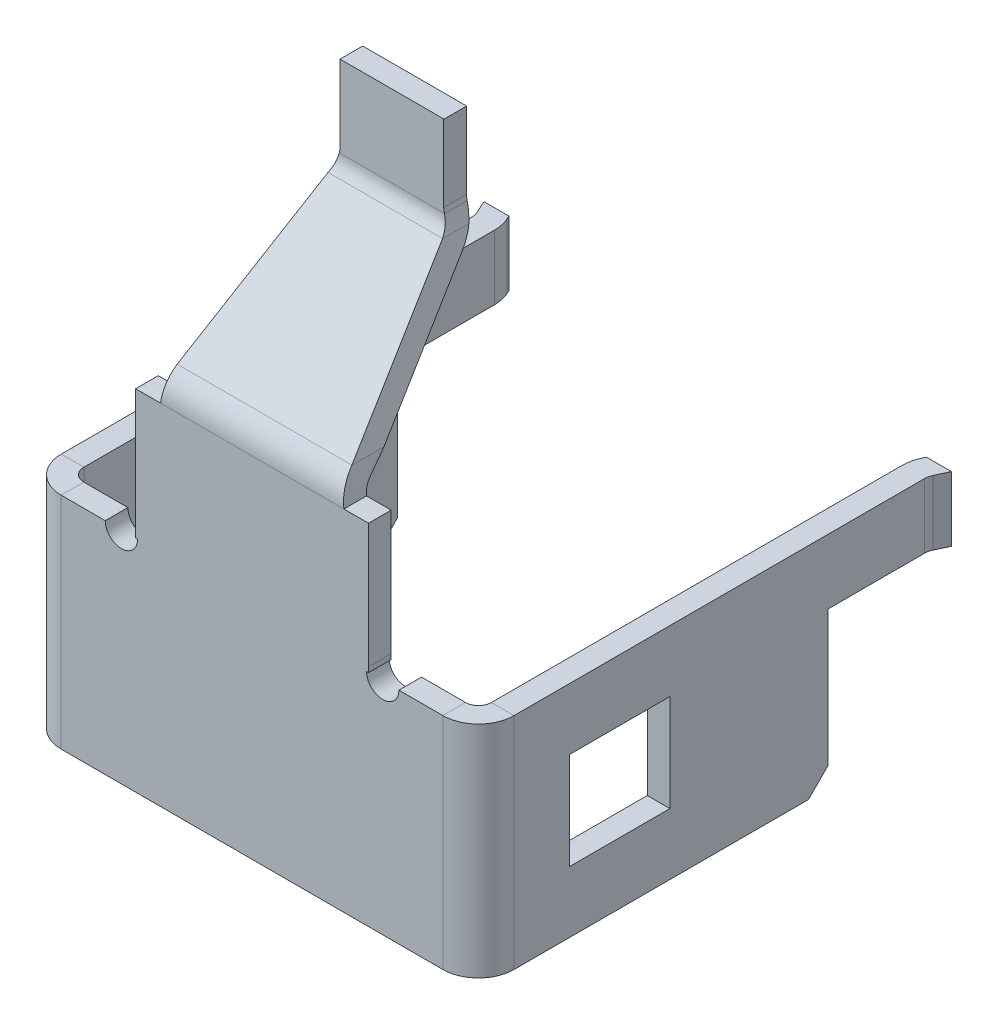
from build123d import *

# Parameters (mm, degrees)
DODANIE_WYCI_GNI_CIE1_DEPTH     = 0.35
DODANIE_WYCI_GNI_CIE2_DEPTH     = 3.4
WYTNIJ_WYCI_GNI_CIE1_DEPTH      = 12.253852902
WYTNIJ_WYCI_GNI_CIE1_DEPTH_BACK = 12.253852902
SZKIC3_W                        = 1.55
SZKIC3_H                        = 1.5
KONWERTUJ_BRY_1_DEPTH           = 3.4
KONWERTUJ_BRY_1_2_DEPTH         = 3.4
DODANIE_WYCI_GNI_CIE3_DEPTH     = 1
DODANIE_WYCI_GNI_CIE4_START     = -1.7
DODANIE_WYCI_GNI_CIE4_DEPTH     = 3.6
WYTNIJ_WYCI_GNI_CIE2_DEPTH      = 13.252457687


# Read off the part's stored shape, not the designer's step: Konwertuj bryłę1
with BuildPart() as part:
    # Szkic1 → Dodanie-wyciągnięcie1 (new body)
    with BuildSketch(Plane.XY):
        with BuildLine():
            Line((3.5, 0), (3.5, 3.4))
            Line((3.5, 3.4), (3.1, 3.4))
            Line((3.1, 3.4), (2.269798394, 3.4))
            ThreePointArc((2.269798394, 3.4), (2.019798394, 3.15), (1.769798394, 3.4))
            Line((1.769798394, 3.4), (1.417144432, 5.4))
            Line((1.417144432, 5.4), (-1.417144432, 5.4))
            Line((-1.417144432, 5.4), (-1.769798394, 3.4))
            ThreePointArc((-1.769798394, 3.4), (-2.019798394, 3.15), (-2.269798394, 3.4))
            Line((-2.269798394, 3.4), (-3.1, 3.4))
            Line((-3.1, 3.4), (-3.5, 3.4))
            Line((-3.5, 3.4), (-3.5, 0))
            Line((-3.5, 0), (-3.1, 0))
            Line((-3.1, 0), (3.1, 0))
            Line((3.1, 0), (3.5, 0))
        make_face()
    extrude(amount=DODANIE_WYCI_GNI_CIE1_DEPTH)

    # Szkic2 → Dodanie-wyciągnięcie2 (add)
    with BuildSketch(Plane.XZ):
        with BuildLine():
            Line((3.15, -5.046862694), (3.15, -6.546862697))
            ThreePointArc((3.15, -6.546862697), (3.164222396, -6.676726465), (3.206215328, -6.800433654))
            Line((3.206215328, -6.800433654), (3.227865546, -6.846862697))
            Line((3.227865546, -6.846862697), (3.614047818, -6.846862697))
            Line((3.614047818, -6.846862697), (3.523423053, -6.652517262))
            ThreePointArc((3.523423053, -6.652517262), (3.505925998, -6.6009726), (3.5, -6.546862697))
            Line((3.5, -6.546862697), (3.5, -5.046862694))
            Line((3.5, -5.046862694), (3.5, -4.746862694))
            Line((3.5, -4.746862694), (3.5, -0.046862697))
            Line((3.5, -0.046862697), (3.5, 0))
            Line((3.5, 0), (3.15, 0))
            Line((3.15, 0), (3.15, -0.046862697))
            Line((3.15, -0.046862697), (3.15, -4.746862694))
            Line((3.15, -4.746862694), (3.15, -5.046862694))
        make_face()
    dodanie_wyci_gni_cie2 = extrude(amount=-DODANIE_WYCI_GNI_CIE2_DEPTH)

    # Lustro1: Dodanie-wyciągnięcie2 across plane
    add(dodanie_wyci_gni_cie2.mirror(Plane(origin=(0, 0, 0), x_dir=(0, 0, 1), z_dir=(1, 0, 0))))

    # Szkic3 → Wytnij-wyciągnięcie1 (cut, two sides: drawn at the far end of the back side and taken through both)
    with BuildSketch(Plane(origin=(3.5, 0, 0), x_dir=(0, 0, -1), z_dir=(1, 0, 0)).offset(-WYTNIJ_WYCI_GNI_CIE1_DEPTH_BACK)):
        with Locations((1.834568124, 1.7)):
            Rectangle(SZKIC3_W, SZKIC3_H)
        Polygon((6.85, 2.4), (6.655654565, 2.4), (6.55, 2.4), (6.546862697, 2.4), (6.546862697, 0), (4.749999997, 0), (4.618517663, -2.046100673), (8.285753876, -1.25448224), align=None)
        Polygon((6.546862697, 0), (6.546862697, 2.4), (5.049999997, 2.4), (5.049999997, 0.3), (4.749999997, 0), align=None)
    extrude(amount=WYTNIJ_WYCI_GNI_CIE1_DEPTH + WYTNIJ_WYCI_GNI_CIE1_DEPTH_BACK, mode=Mode.SUBTRACT)

    # Konwertuj bryłę1 outline → Konwertuj bryłę1 (cut)
    with BuildSketch(Plane(origin=(0, 0, 0), x_dir=(1, 0, 0), z_dir=(0, 1, 0))):
        with BuildLine():
            Line((3.15, 6.546862697), (3.5, 6.546862697))
            ThreePointArc((3.5, 6.546862697), (3.505925998, 6.6009726), (3.523423053, 6.652517262))
            Line((3.523423053, 6.652517262), (3.614047818, 6.846862697))
            Line((3.614047818, 6.846862697), (3.227865546, 6.846862697))
            Line((3.227865546, 6.846862697), (3.206215328, 6.800433654))
            ThreePointArc((3.206215328, 6.800433654), (3.164222396, 6.676726465), (3.15, 6.546862697))
        make_face()
        with BuildLine():
            Line((3.5, -0.35), (3.5, 0.2))
            ThreePointArc((3.5, 0.2), (3.33890873, -0.18890873), (2.95, -0.35))
            Line((2.95, -0.35), (3.5, -0.35))
        make_face()
        with BuildLine():
            Line((-3.5, -0.35), (-2.95, -0.35))
            ThreePointArc((-2.95, -0.35), (-3.33890873, -0.18890873), (-3.5, 0.2))
            Line((-3.5, 0.2), (-3.5, -0.35))
        make_face()
        with BuildLine():
            ThreePointArc((-3.523423053, 6.652517262), (-3.505925998, 6.6009726), (-3.5, 6.546862697))
            Line((-3.5, 6.546862697), (-3.15, 6.546862697))
            ThreePointArc((-3.15, 6.546862697), (-3.164222396, 6.676726465), (-3.206215328, 6.800433654))
            Line((-3.206215328, 6.800433654), (-3.227865546, 6.846862697))
            Line((-3.227865546, 6.846862697), (-3.614047818, 6.846862697))
            Line((-3.614047818, 6.846862697), (-3.523423053, 6.652517262))
        make_face()
    extrude(amount=KONWERTUJ_BRY_1_DEPTH, mode=Mode.SUBTRACT)

    # Konwertuj bry_1 2 outline → Konwertuj bry_1 2 (add)
    with BuildSketch(Plane(origin=(0, 0, 0), x_dir=(1, 0, 0), z_dir=(0, 1, 0))):
        with BuildLine():
            Line((3.15, 0), (3.15, 0.2))
            ThreePointArc((3.15, 0.2), (3.091421356, 0.058578644), (2.95, 0))
            Line((2.95, 0), (3.15, 0))
        make_face()
        with BuildLine():
            Line((-3.15, 0), (-2.95, 0))
            ThreePointArc((-2.95, 0), (-3.091421356, 0.058578644), (-3.15, 0.2))
            Line((-3.15, 0.2), (-3.15, 0))
        make_face()
    extrude(amount=KONWERTUJ_BRY_1_2_DEPTH)

    # Szkic8 → Dodanie-wyciągnięcie3 (add)
    with BuildSketch(Plane.XZ.offset(-2.4)):
        with BuildLine():
            Line((3.206215328, -6.800433654), (3.227865546, -6.846862697))
            Line((3.227865546, -6.846862697), (3.614047818, -6.846862697))
            Line((3.614047818, -6.846862697), (3.523423053, -6.652517262))
            ThreePointArc((3.523423053, -6.652517262), (3.505925998, -6.6009726), (3.5, -6.546862697))
            Line((3.5, -6.546862697), (3.15, -6.546862697))
            ThreePointArc((3.15, -6.546862697), (3.164222396, -6.676726465), (3.206215328, -6.800433654))
        make_face()
    dodanie_wyci_gni_cie3 = extrude(amount=-DODANIE_WYCI_GNI_CIE3_DEPTH)

    # Lustro2: Dodanie-wyciągnięcie3 across plane
    add(dodanie_wyci_gni_cie3.mirror(Plane(origin=(0, 0, 0), x_dir=(0, 0, 1), z_dir=(1, 0, 0))))

    # Szkic9 → Dodanie-wyciągnięcie4 (add)
    with BuildSketch(Plane(origin=(3.5, 0, 0), x_dir=(0, 0, -1), z_dir=(1, 0, 0)).offset(DODANIE_WYCI_GNI_CIE4_START)):
        with BuildLine():
            Line((2.159795211, 8.048412492), (2.159795211, 9.233988579))
            Line((2.159795211, 9.233988579), (1.809795211, 9.233988579))
            Line((1.809795211, 9.233988579), (1.809795211, 8.048412492))
            Line((1.809795211, 8.048412492), (1.809795211, 7.974008773))
            ThreePointArc((1.809795211, 7.974008773), (1.783153047, 7.840069572), (1.707282584, 7.7265214))
            Line((1.707282584, 7.7265214), (-0.159619408, 5.859619408))
            ThreePointArc((-0.159619408, 5.859619408), (-0.300521696, 5.648744231), (-0.35, 5.4))
            Line((-0.35, 5.4), (-0.35, 3.4))
            Line((-0.35, 3.4), (0, 3.4))
            Line((0, 3.4), (0, 5.4))
            ThreePointArc((0, 5.4), (0.02283614, 5.51480503), (0.087867966, 5.612132034))
            Line((0.087867966, 5.612132034), (1.954769957, 7.479034026))
            ThreePointArc((1.954769957, 7.479034026), (2.106510883, 7.70613037), (2.159795211, 7.974008773))
            Line((2.159795211, 7.974008773), (2.159795211, 8.048412492))
        make_face()
    extrude(amount=-DODANIE_WYCI_GNI_CIE4_DEPTH)

    # Szkic10 → Wytnij-wyciągnięcie2 (cut, through all)
    with BuildSketch(Plane.XY.offset(0.35)):
        with BuildLine():
            Line((-1.8, 5.4), (-1.414602313, 5.4))
            add(Edge.make_bspline(
                [(-1.349117856, 5.857315964), (-1.37109798, 5.736696856), (-1.392626241, 5.570542489), (-1.414602313, 5.4)],
                knots=[0, 0, 0, 0, 0.995518499, 0.995518499, 0.995518499, 0.995518499], degree=3))
            Line((-1.349117856, 5.857315964), (-0.883579694, 7.724217956))
            add(Edge.make_bspline(
                [(-0.810874078, 7.971705329), (-0.835264826, 7.87948746), (-0.859188951, 7.789425824), (-0.883579694, 7.724217956)],
                knots=[0, 0, 0, 0, 1, 1, 1, 1], degree=3))
            Line((-0.810874078, 7.971705329), (-0.797754695, 8.04610905))
            Line((-0.797754695, 8.04610905), (-0.797754695, 9.231685135))
            Line((-0.797754695, 9.231685135), (-0.993203543, 9.461775101))
            Line((-0.993203543, 9.461775101), (-2.257838498, 9.461775101))
            Line((-2.257838498, 9.461775101), (-2.100122127, 3.339055662))
            Line((-2.100122127, 3.339055662), (-1.769812995, 3.397298074))
            ThreePointArc((-1.769812995, 3.397298074), (-1.769802044, 3.398649017), (-1.769798394, 3.4))
            Line((-1.769798394, 3.4), (-1.8, 3.4))
            Line((-1.8, 3.4), (-1.8, 5.4))
        make_face()
        with BuildLine():
            Line((1.8, 5.4), (1.8, 3.47771191))
            Line((1.8, 3.47771191), (2.752350462, 6.206517892))
            Line((2.752350462, 6.206517892), (2.752350462, 10.079155902))
            Line((2.752350462, 10.079155902), (0.802245305, 9.231685135))
            Line((0.802245305, 9.231685135), (0.802245305, 8.04568496))
            Line((0.802245305, 8.04568496), (0.815154302, 7.972474402))
            add(Edge.make_bspline(
                [(0.888230882, 7.723724279), (0.863715686, 7.789264869), (0.839669493, 7.879786029), (0.815154302, 7.972474402)],
                knots=[0, 0, 0, 0, 1, 1, 1, 1], degree=3))
            Line((0.888230882, 7.723724279), (1.353548426, 5.857707011))
            add(Edge.make_bspline(
                [(1.419093822, 5.4), (1.3970978, 5.570696055), (1.375549103, 5.736975116), (1.353548426, 5.857707011)],
                knots=[0.005151663, 0.005151663, 0.005151663, 0.005151663, 1, 1, 1, 1], degree=3))
            Line((1.419093822, 5.4), (1.8, 5.4))
        make_face()
    extrude(amount=-WYTNIJ_WYCI_GNI_CIE2_DEPTH, mode=Mode.SUBTRACT)


solid = part.part
